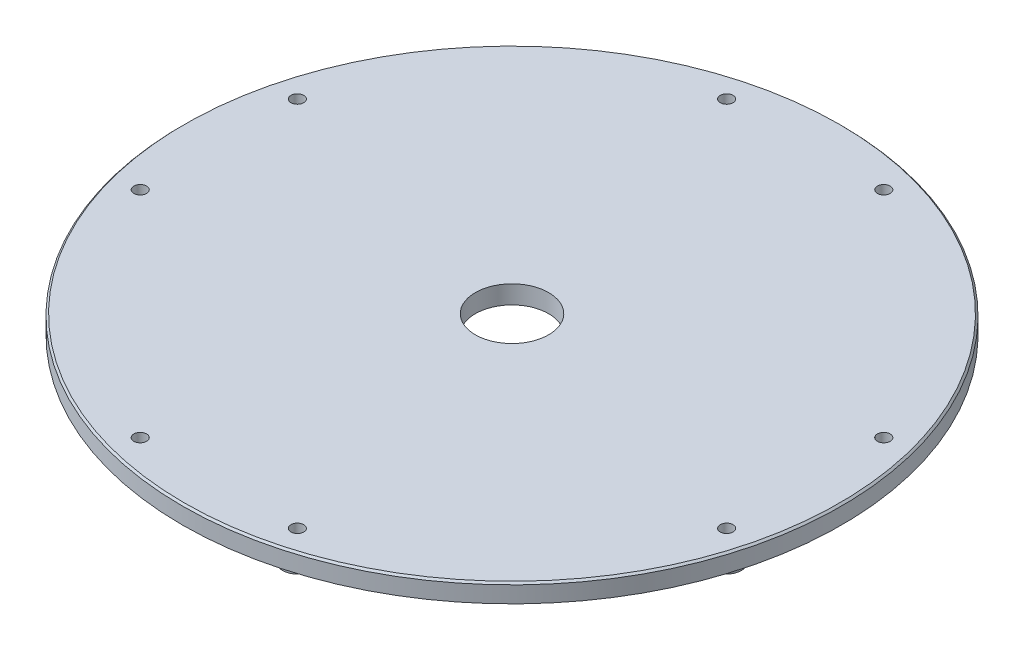
from build123d import *

# Parameters (mm, degrees)
SKIZZE1_R                       = 90
AUFSATZ_LINEAR_AUSTRAGEN1_DEPTH = 5
SKIZZE2_W                       = 6
SKIZZE2_H                       = 10
AUFSATZ_LINEAR_AUSTRAGEN2_DEPTH = 14
FASE1_SIZE                      = 14
SKIZZE3_R                       = 2.15
SCHNITT_LINEAR_AUSTRAGEN1_DEPTH = 42
KREISMUSTER1_COUNT              = 3
FASE1_OF_KREISMUSTER1_SIZE      = 14
AUFSATZ_LINEAR_AUSTRAGEN3_DEPTH = 3
AUFSATZ_LINEAR_AUSTRAGEN4_DEPTH = 3
SCHNITT_LINEAR_AUSTRAGEN2_REACH = 129.754
SKIZZE7_R                       = 1.75
KREISMUSTER2_COUNT              = 4
SCHNITT_LINEAR_AUSTRAGEN3_REACH = 130.69
SKIZZE8_R                       = 10
FASE2_SIZE                      = 0.5


with BuildPart() as part:
    # Skizze1 → Aufsatz-Linear austragen1 (new body)
    with BuildSketch(Plane(origin=(0, 0, 0), x_dir=(1, 0, 0), z_dir=(0, 1, 0))):
        with Locations(Location((0, 0, 0), (0, 0, 270))):
            Circle(SKIZZE1_R)
    extrude(amount=AUFSATZ_LINEAR_AUSTRAGEN1_DEPTH)

    # Skizze2 → Aufsatz-Linear austragen2 (add)
    with BuildSketch(Plane.XZ):
        with Locations((-18, 35)):
            Rectangle(SKIZZE2_W, SKIZZE2_H)
        with Locations((18, 35)):
            Rectangle(SKIZZE2_W, SKIZZE2_H)
    aufsatz_linear_austragen2 = extrude(amount=AUFSATZ_LINEAR_AUSTRAGEN2_DEPTH)

    # Fase1
    fase1_edges = [part.edges().sort_by_distance(p)[0] for p in [
        (18, 0, 40),
        (-18, 0, 40),
    ]]
    chamfer(fase1_edges, length=FASE1_SIZE - 0.0001)  # a hair under: the kernel refuses the full size

    # Skizze3 → Schnitt-Linear austragen1 (cut)
    with BuildSketch(Plane(origin=(21, 0, 0), x_dir=(0, 0, -1), z_dir=(1, 0, 0))):
        with Locations((-35, -7)):
            Circle(SKIZZE3_R)
    schnitt_linear_austragen1 = extrude(amount=-SCHNITT_LINEAR_AUSTRAGEN1_DEPTH, mode=Mode.SUBTRACT)

    # Kreismuster1: Aufsatz-Linear austragen2, Schnitt-Linear austragen1 ×3 about axis
    kreismuster1_axis = Axis((0, 0, 0), (0, 1, 0))
    add([aufsatz_linear_austragen2.rotate(kreismuster1_axis, i * 360 / KREISMUSTER1_COUNT) for i in range(1, KREISMUSTER1_COUNT)])
    add([schnitt_linear_austragen1.rotate(kreismuster1_axis, i * 360 / KREISMUSTER1_COUNT) for i in range(1, KREISMUSTER1_COUNT)], mode=Mode.SUBTRACT)

    # Fase1 of Kreismuster1
    fase1_of_kreismuster1_edges = [part.edges().sort_by_distance(p)[0] for p in [
        (25.641016151, 0, -35.588457268),
        (43.641016151, 0, -4.411542732),
        (-43.641016151, 0, -4.411542732),
        (-25.641016151, 0, -35.588457268),
    ]]
    chamfer(fase1_of_kreismuster1_edges, length=FASE1_OF_KREISMUSTER1_SIZE - 0.0001)  # a hair under: the kernel refuses the full size

    # Skizze4 → Aufsatz-Linear austragen3 (add)
    with BuildSketch(Plane.XZ):
        with BuildLine():
            ThreePointArc((-70.255477849, -23.241510972), (-64.08587988, 37), (-15, 72.463784058))
            Line((-15, 72.463784058), (-15, 78.581168228))
            ThreePointArc((-15, 78.581168228), (-69.282032303, 40), (-75.553287944, -26.300203057))
            Line((-75.553287944, -26.300203057), (-70.255477849, -23.241510972))
        make_face()
        with BuildLine():
            Line((15, 78.581168228), (15, 72.463784058))
            ThreePointArc((15, 72.463784058), (57.384666942, 46.722585545), (74, 0))
            ThreePointArc((74, 0), (73.057872132, -11.770612542), (70.255477849, -23.241510972))
            Line((70.255477849, -23.241510972), (75.553287944, -26.300203057))
            ThreePointArc((75.553287944, -26.300203057), (78.880488828, -13.336734317), (80, 0))
            ThreePointArc((80, 0), (61.64414003, 50.990195136), (15, 78.581168228))
        make_face()
        with BuildLine():
            ThreePointArc((55.255477849, -49.222273086), (0, -74), (-55.255477849, -49.222273086))
            Line((-55.255477849, -49.222273086), (-60.553287944, -52.280965171))
            ThreePointArc((-60.553287944, -52.280965171), (0, -80), (60.553287944, -52.280965171))
            Line((60.553287944, -52.280965171), (55.255477849, -49.222273086))
        make_face()
        with BuildLine():
            Line((15.480762114, -33.186533479), (18.480762114, -27.990381057))
            ThreePointArc((18.480762114, -27.990381057), (0, -33.541019662), (-18.480762114, -27.990381057))
            Line((-18.480762114, -27.990381057), (-15.480762114, -33.186533479))
            ThreePointArc((-15.480762114, -33.186533479), (0, -36.619666847), (15.480762114, -33.186533479))
        make_face()
        with BuildLine():
            ThreePointArc((-33.480762114, -2.009618943), (-29.047375097, 16.770509831), (-15, 30))
            Line((-15, 30), (-21, 30))
            ThreePointArc((-21, 30), (-31.713561768, 18.309833424), (-36.480762114, 3.186533479))
            Line((-36.480762114, 3.186533479), (-33.480762114, -2.009618943))
        make_face()
        with BuildLine():
            ThreePointArc((15, 30), (28.531695489, 17.633557569), (33.541019662, 0))
            ThreePointArc((33.541019662, 0), (33.525951891, -1.005261069), (33.480762114, -2.009618943))
            Line((33.480762114, -2.009618943), (36.480762114, 3.186533479))
            ThreePointArc((36.480762114, 3.186533479), (31.713561768, 18.309833424), (21, 30))
            Line((21, 30), (15, 30))
        make_face()
    extrude(amount=AUFSATZ_LINEAR_AUSTRAGEN3_DEPTH)

    # Skizze6 → Aufsatz-Linear austragen4 (add)
    with BuildSketch(Plane.XZ):
        with BuildLine():
            Line((-24.543328812, -76.142136894), (-25.319785948, -79.039914373))
            ThreePointArc((-25.319785948, -79.039914373), (-22.491358823, -83.938893859), (-17.592379337, -81.110466734))
            Line((-17.592379337, -81.110466734), (-16.815922202, -78.212689255))
            Line((-16.815922202, -78.212689255), (-24.543328812, -76.142136894))
        make_face()
        with BuildLine():
            Line((24.543328812, -76.142136894), (16.815922202, -78.212689255))
            Line((16.815922202, -78.212689255), (17.592379337, -81.110466734))
            ThreePointArc((17.592379337, -81.110466734), (22.491358823, -83.938893859), (25.319785948, -79.039914373))
            Line((25.319785948, -79.039914373), (24.543328812, -76.142136894))
        make_face()
    aufsatz_linear_austragen4 = extrude(amount=AUFSATZ_LINEAR_AUSTRAGEN4_DEPTH)

    # Skizze7 → Schnitt-Linear austragen2 (cut, up to next)
    with BuildSketch(Plane.XZ.offset(3), mode=Mode.PRIVATE) as schnitt_linear_austragen2_sk1:
        with Locations(Location((-21.456082643, -80.075190553, 0), (0, 0, 270))):
            Circle(SKIZZE7_R)
    schnitt_linear_austragen2_tool1 = extrude(schnitt_linear_austragen2_sk1.sketch, amount=-SCHNITT_LINEAR_AUSTRAGEN2_REACH, mode=Mode.PRIVATE) & part.part
    # Skizze7 → Schnitt-Linear austragen2 (cut, up to next)
    with BuildSketch(Plane.XZ.offset(3), mode=Mode.PRIVATE) as schnitt_linear_austragen2_sk2:
        with Locations(Location((21.456082643, -80.075190553, 0), (0, 0, 270))):
            Circle(SKIZZE7_R)
    schnitt_linear_austragen2_tool2 = extrude(schnitt_linear_austragen2_sk2.sketch, amount=-SCHNITT_LINEAR_AUSTRAGEN2_REACH, mode=Mode.PRIVATE) & part.part
    schnitt_linear_austragen2_1 = schnitt_linear_austragen2_tool1.solids().sort_by_distance((-21.456083, -3, -80.075191))[0]
    add(schnitt_linear_austragen2_1, mode=Mode.SUBTRACT)
    schnitt_linear_austragen2_2 = schnitt_linear_austragen2_tool2.solids().sort_by_distance((21.456083, -3, -80.075191))[0]
    add(schnitt_linear_austragen2_2, mode=Mode.SUBTRACT)
    schnitt_linear_austragen2 = schnitt_linear_austragen2_1 + schnitt_linear_austragen2_2  # Schnitt-Linear austragen2 as one shape, for the pattern or mirror that repeats it

    # Kreismuster2: Aufsatz-Linear austragen4, Schnitt-Linear austragen2 ×4 about axis
    kreismuster2_axis = Axis((0, 0, 0), (0, 1, 0))
    add([aufsatz_linear_austragen4.rotate(kreismuster2_axis, i * 360 / KREISMUSTER2_COUNT) for i in range(1, KREISMUSTER2_COUNT)])
    add([schnitt_linear_austragen2.rotate(kreismuster2_axis, i * 360 / KREISMUSTER2_COUNT) for i in range(1, KREISMUSTER2_COUNT)], mode=Mode.SUBTRACT)

    # Skizze8 → Schnitt-Linear austragen3 (cut, up to next)
    with BuildSketch(Plane(origin=(0, 5, 0), x_dir=(1, 0, 0), z_dir=(0, 1, 0)), mode=Mode.PRIVATE) as schnitt_linear_austragen3_sk1:
        with Locations(Location((0, 0, 0), (0, 0, 270))):
            Circle(SKIZZE8_R)
    schnitt_linear_austragen3_tool1 = extrude(schnitt_linear_austragen3_sk1.sketch, amount=-SCHNITT_LINEAR_AUSTRAGEN3_REACH, mode=Mode.PRIVATE) & part.part
    add(schnitt_linear_austragen3_tool1.solids().sort_by_distance((0, 5, 0))[0], mode=Mode.SUBTRACT)

    # Fase2
    fase2_edges = [part.edges().sort_by_distance(p)[0] for p in [
        (0, 5, -90),
    ]]
    chamfer(fase2_edges, length=FASE2_SIZE)


solid = part.part
